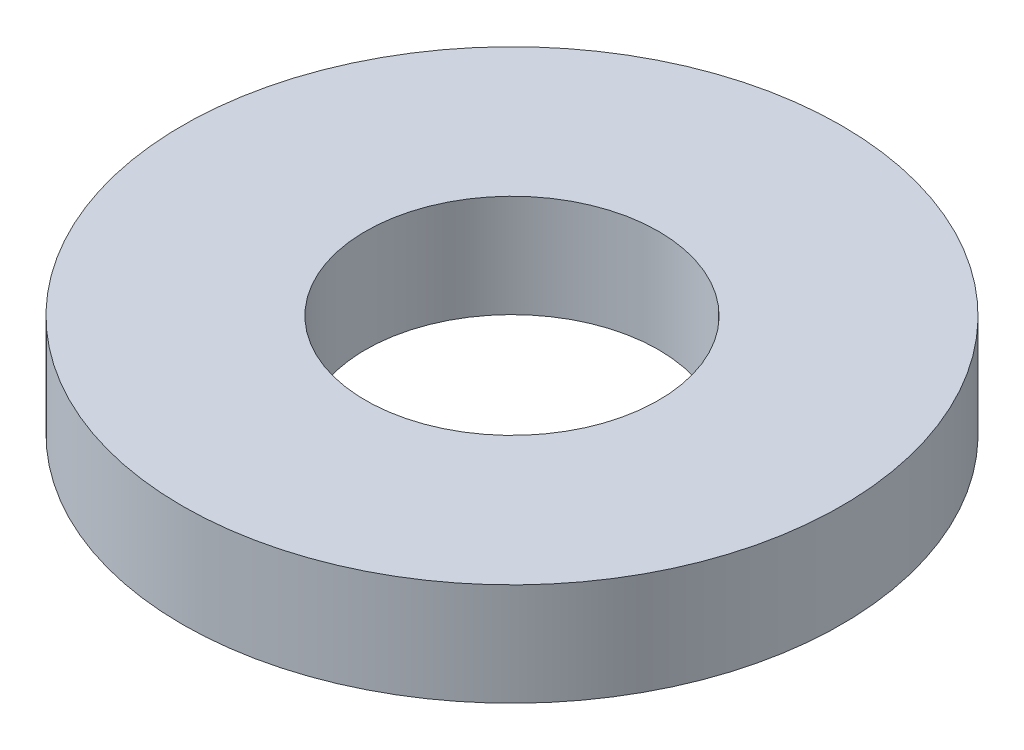
from build123d import *

# Parameters (mm, degrees)
SKETCH1_R           = 67.5
BOSS_EXTRUDE1_DEPTH = 21
SKETCH2_R           = 30
CUT_EXTRUDE1_DEPTH  = 98.742007346


with BuildPart() as part:
    # Sketch1 → Boss-Extrude1 (new body)
    with BuildSketch(Plane(origin=(0, 0, 0), x_dir=(1, 0, 0), z_dir=(0, 1, 0))):
        Circle(SKETCH1_R)
    extrude(amount=BOSS_EXTRUDE1_DEPTH)

    # Sketch2 → Cut-Extrude1 (cut, through all)
    with BuildSketch(Plane(origin=(0, 0, 0), x_dir=(1, 0, 0), z_dir=(0, 1, 0))):
        Circle(SKETCH2_R)
    extrude(amount=CUT_EXTRUDE1_DEPTH, mode=Mode.SUBTRACT)


solid = part.part
